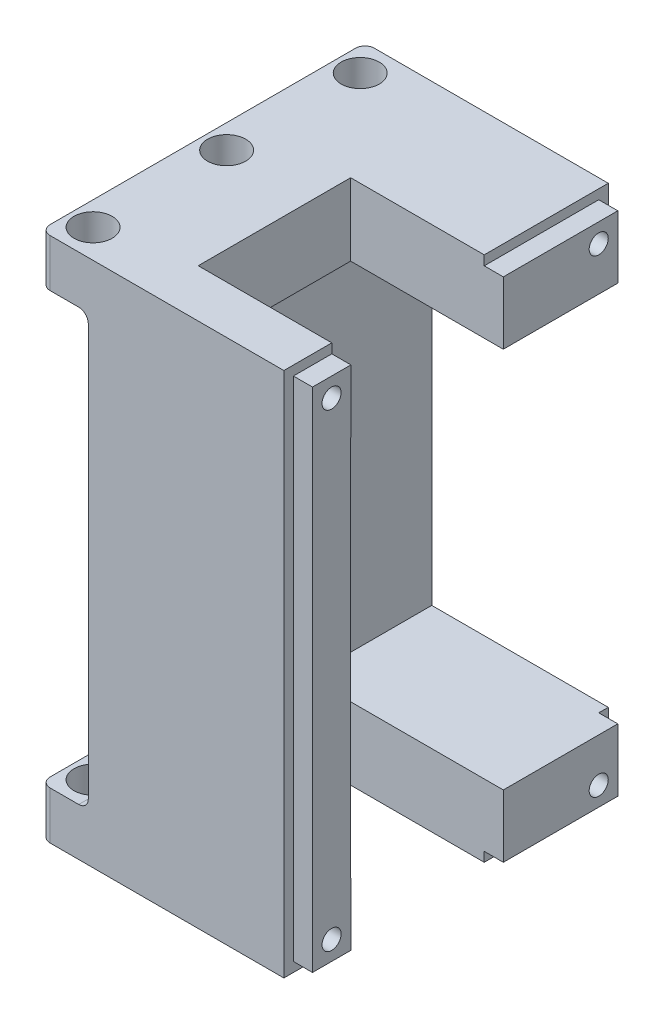
from build123d import *

# Parameters (mm, degrees)
SKETCH_1_R           = 2.000000000000001
EXTRUDE_1_DEPTH      = 29
SKETCH_2_W           = 20.5
SKETCH_2_H           = 70.28340969233892
EXTRUDE_2_DEPTH      = 3
SKETCH_3_W           = 20.5
SKETCH_3_H           = 7.570852423084727
CUT_EXTRUDE_1_DEPTH  = 49.62100286394029
SKETCH_5_R           = 2.5
EXTRUDE_3_DEPTH      = 10
CUT_EXTRUDE_2_REACH  = 75.297
SKETCH_8_R           = 1.6000000000000003
SKETCH_9_W           = 20.5
SKETCH_9_H           = 32
CUT_EXTRUDE_3_DEPTH  = 65.57298284377197
SKETCH_12_W          = 20.499999999999996
SKETCH_12_H          = 7.57085242308473
SKETCH_12_R          = 2.0000000000000018
SKETCH_12_R_2        = 2.000000000000001
EXTRUDE_5_DEPTH      = 30
EXTRUDE_6_DEPTH      = 10
SKETCH_16_R          = 1.5000000000000004
CUT_EXTRUDE_5_DEPTH  = 48.388093987806805
SKETCH_17_R          = 1.5000000000000004
CUT_EXTRUDE_6_DEPTH  = 51.404676958704755
EXTRUDE_START        = 10
SKETCH_19_R          = 4
SKETCH_19_R_2        = 2.5000000000000004
EXTRUDE_7_DEPTH      = 10
SKETCH_21_R          = 1.5000000000000004
CUT_EXTRUDE_7_DEPTH  = 48.38809406709012
SKETCH_22_R          = 1.5000000000000004
CUT_EXTRUDE_8_DEPTH  = 51.404676958704755
SKETCH_23_W          = 20.5
SKETCH_23_H          = 55.141704846169446
EXTRUDE_8_DEPTH      = 2
EXTRUDE_9_DEPTH      = 2
CUT_EXTRUDE_9_DEPTH  = 16
EXTRUDE_START_2      = 20
SKETCH_26_R          = 2.000000000000003
SKETCH_26_R_2        = 2.000000000000001
SKETCH_26_R_3        = 2.000000000000002
EXTRUDE_10_DEPTH     = 20
SKETCH_27_W          = 16
SKETCH_27_H          = 8.000000000000007
CUT_EXTRUDE_10_DEPTH = 75.49499461906014
SKETCH_29_W          = 34
SKETCH_29_H          = 55.14170484616947
CUT_EXTRUDE_11_DEPTH = 2
SKETCH_32_W          = 3.9768627953179667
SKETCH_32_H          = 6.57085242308473
CUT_EXTRUDE_13_DEPTH = 16
SKETCH_33_R          = 1.0000000000000018
CUT_EXTRUDE_14_DEPTH = 16
SKETCH_35_R          = 1.0000000000000004
CUT_EXTRUDE_15_DEPTH = 5
SKETCH_36_R          = 2.65
CUT_EXTRUDE_16_DEPTH = 10
CUT_EXTRUDE_START    = -10
SKETCH_37_R          = 2.65
CUT_EXTRUDE_17_DEPTH = 10
SKETCH_38_W          = 37
SKETCH_38_H          = 68
CUT_EXTRUDE_18_DEPTH = 10
SKETCH_39_W          = 24.000000000000007
SKETCH_39_H          = 55.141704846169446
EXTRUDE_11_DEPTH     = 2
SKETCH_40_W          = 20.5
SKETCH_40_H          = 34
CUT_EXTRUDE_19_DEPTH = 66.92928115292985
EXTRUDE_12_DEPTH     = 5
SKETCH_42_R          = 1.9999999999999991
SKETCH_42_R_2        = 1.9999999999999996
SKETCH_42_R_3        = 2
CUT_EXTRUDE_20_DEPTH = 68.03857183250602
FILLET_1_R           = 1
FILLET_2_R           = 1
FILLET_3_R           = 1
FILLET_4_R           = 1
FILLET_5_R           = 1
FILLET_6_R           = 1


with BuildPart() as part:
    # 草图1 → 凸台-拉伸1 (new body)
    # profile 1 of 3: a face of its own
    with BuildSketch(Plane.XY):
        with BuildLine():
            Line((-10.250000000000004, 35.14170484616946), (-10.250000000000004, 20))
            Line((-10.25, 20.000000000000004), (-4.999999999999999, 20.000000000000004))
            Line((-4.999999999999999, 20.000000000000004), (-4.999999999999999, 23.000000000000004))
            ThreePointArc((-5.000000000000001, 23.000000000000004), (-6.414213562373094, 26.4142135623731), (-2.9999999999999982, 25.000000000000004))
            Line((-2.9999999999999982, 25.000000000000004), (3, 25.000000000000004))
            ThreePointArc((3, 25.000000000000004), (5.000000000000001, 27.000000000000004), (7.000000000000002, 25.000000000000004))
            ThreePointArc((7.000000000000002, 25.000000000000004), (6.414213562373095, 23.585786437626908), (4.999999999999999, 23.000000000000004))
            Line((5.000000000000001, 23.000000000000004), (5.000000000000001, 20.000000000000004))
            Line((5, 20.000000000000004), (10.249999999999996, 20.000000000000004))
            Line((10.249999999999996, 20), (10.249999999999996, 35.14170484616946))
            Line((10.249999999999996, 35.14170484616946), (-10.250000000000004, 35.14170484616946))
        make_face()
    # profile 2 of 3: a face of its own
    with BuildSketch(Plane.XY):
        Polygon((10.249999999999996, -20), (-10.25, -20), (-10.250000000000004, -35.14170484616946), (10.249999999999996, -35.14170484616946), align=None)
        with Locations(Location((-4.999999999999999, -25.000000000000004, 0), (0, 0, 180))):
            Circle(SKETCH_1_R, mode=Mode.SUBTRACT)
        with Locations(Location((5.000000000000001, -25.000000000000004, 0), (0, 0, 180))):
            Circle(SKETCH_1_R, mode=Mode.SUBTRACT)
    # profile 3 of 3: a face of its own
    with BuildSketch(Plane.XY):
        with BuildLine():
            Line((-4.999999999999999, 23.000000000000004), (-4.999999999999999, 20.000000000000004))
            Line((-4.999999999999999, 20.000000000000004), (5, 20.000000000000004))
            Line((5.000000000000001, 20.000000000000004), (5.000000000000001, 23.000000000000004))
            ThreePointArc((4.999999999999999, 23.000000000000004), (3.585786437626904, 23.585786437626908), (3, 25.000000000000004))
            Line((3, 25.000000000000004), (-2.9999999999999982, 25.000000000000004))
            ThreePointArc((-2.9999999999999982, 25.000000000000004), (-3.585786437626905, 23.585786437626908), (-5.000000000000001, 23.000000000000004))
        make_face()
    extrude(amount=EXTRUDE_1_DEPTH)

    # 草图2 → 凸台-拉伸2 (add)
    with BuildSketch(Plane.XY.offset(29)):
        Rectangle(SKETCH_2_W, SKETCH_2_H)
    extrude(amount=EXTRUDE_2_DEPTH)

    # 草图3 → 切除-拉伸1 (cut, through all)
    with BuildSketch(Plane(origin=(0, 0, 0), x_dir=(-1, 0, 0), z_dir=(0, 0, -1))):
        with Locations((3.55e-15, -31.356278634627095)):
            Rectangle(SKETCH_3_W, SKETCH_3_H)
        Polygon((-10.249999999999996, 35.14170484616946), (-10.249999999999996, 27.57085242308473), (10.250000000000004, 27.570852423084734), (10.250000000000004, 35.14170484616946), align=None)
    extrude(amount=-CUT_EXTRUDE_1_DEPTH, mode=Mode.SUBTRACT)

    # 草图5 → 凸台-拉伸3 (add)
    with BuildSketch(Plane.XZ.offset(27.570852423084734)):
        with Locations(Location((0, 2.5, 0), (0, 0, 270))):
            Circle(SKETCH_5_R)
    extrude(amount=EXTRUDE_3_DEPTH)

    # 草图8 → 切除-拉伸2 (cut, up to next)
    with BuildSketch(Plane(origin=(0, 27.570852423084734, 0), x_dir=(1, 0, 0), z_dir=(0, 1, 0)), mode=Mode.PRIVATE) as cut_extrude_2_sk1:
        with Locations(Location((1.71e-15, -16.5, 0), (0, 0, 270))):
            Circle(SKETCH_8_R)
    cut_extrude_2_tool1 = extrude(cut_extrude_2_sk1.sketch, amount=-CUT_EXTRUDE_2_REACH, mode=Mode.PRIVATE) & part.part
    # 草图8 → 切除-拉伸2 (cut, up to next)
    with BuildSketch(Plane(origin=(0, 27.570852423084734, 0), x_dir=(1, 0, 0), z_dir=(0, 1, 0)), mode=Mode.PRIVATE) as cut_extrude_2_sk2:
        with Locations(Location((1.22e-15, -26.500000000000004, 0), (0, 0, 270))):
            Circle(SKETCH_8_R)
    cut_extrude_2_tool2 = extrude(cut_extrude_2_sk2.sketch, amount=-CUT_EXTRUDE_2_REACH, mode=Mode.PRIVATE) & part.part
    add(cut_extrude_2_tool1.solids().sort_by_distance((0, 27.570852, 16.5))[0], mode=Mode.SUBTRACT)
    add(cut_extrude_2_tool2.solids().sort_by_distance((0, 27.570852, 26.5))[0], mode=Mode.SUBTRACT)

    # 草图9 → 切除-拉伸3 (cut, through all)
    with BuildSketch(Plane.XZ.offset(27.570852423084734)):
        with Locations((-3.55e-15, 16)):
            Rectangle(SKETCH_9_W, SKETCH_9_H)
    extrude(amount=CUT_EXTRUDE_3_DEPTH, mode=Mode.SUBTRACT)

    # 草图12 → 凸台-拉伸5 (add)
    with BuildSketch(Plane(origin=(0, 0, 0), x_dir=(-1, 0, 0), z_dir=(0, 0, -1))):
        with Locations((1.78e-15, 23.78542621154237)):
            Rectangle(SKETCH_12_W, SKETCH_12_H)
        with Locations((-5.000000000000001, 25.000000000000004)):
            Circle(SKETCH_12_R, mode=Mode.SUBTRACT)
        with Locations((4.999999999999999, 25.000000000000004)):
            Circle(SKETCH_12_R_2, mode=Mode.SUBTRACT)
    extrude(amount=-EXTRUDE_5_DEPTH)

    # 草图13 → 凸台-拉伸6 (add)
    with BuildSketch(Plane(origin=(0, 27.570852423084734, 0), x_dir=(1, 0, 0), z_dir=(0, 1, 0))):
        with BuildLine():
            ThreePointArc((4.456e-14, -7.5), (-2.5, -5.000000000000058), (-7.084e-14, -2.4999999999999996))
            Line((-1.4e-16, -2.4999999999999996), (-5e-17, -1))
            ThreePointArc((7.635e-14, -1), (-3.9999999999999996, -4.999999999999907), (-1.067e-13, -9))
            Line((-4.9e-16, -9), (-4.1e-16, -7.5))
        make_face()
        with BuildLine():
            Line((-5e-17, -1), (-1.4e-16, -2.4999999999999996))
            ThreePointArc((-7.084e-14, -2.4999999999999996), (1.7677669529663447, -3.2322330470336054), (2.500000000000001, -5))
            ThreePointArc((2.500000000000001, -5.000000000000001), (1.767766952966385, -6.767766952966354), (4.456e-14, -7.5))
            Line((-4.1e-16, -7.5), (-4.9e-16, -9))
            ThreePointArc((-1.067e-13, -9), (2.828427124746152, -7.828427124746229), (4.000000000000001, -5.000000000000001))
            ThreePointArc((4.000000000000001, -5), (2.8284271247462174, -2.171572875253837), (7.635e-14, -1))
        make_face()
    extrude(amount=EXTRUDE_6_DEPTH)

    # 草图15 → 旋转1 (revolve)
    with BuildSketch(Plane(origin=(0, 0, 0), x_dir=(0, 0, -1), z_dir=(1, 0, 0))):
        with BuildLine():
            Line((-1, 27.570852423084734), (0, 27.570852423084734))
            ThreePointArc((0, 27.570852423084734), (-0.7128919117369903, 27.930797461014013), (-1, 28.676011694509246))
            Line((-1, 28.676011694509246), (-1, 27.570852423084734))
        make_face()
    revolve(axis=Axis((0, -962.4291475769152, 4.99999999999657), (0, 1, 3.43e-15)))

    # 草图16 → 切除-拉伸5 (cut, through all)
    with BuildSketch(Plane.XY.offset(5)):
        with Locations(Location((4.9e-16, 33.57085242308473, 0), (0, 0, 90))):
            Circle(SKETCH_16_R)
    extrude(amount=-CUT_EXTRUDE_5_DEPTH, mode=Mode.SUBTRACT)

    # 草图17 → 切除-拉伸6 (cut, through all)
    with BuildSketch(Plane(origin=(0, 0, 0), x_dir=(0, 0, -1), z_dir=(1, 0, 0))):
        with Locations((-5, 33.57085242308473)):
            Circle(SKETCH_17_R)
    extrude(amount=-CUT_EXTRUDE_6_DEPTH, mode=Mode.SUBTRACT)

    # 草图19 → 凸台-拉伸7 (add)
    with BuildSketch(Plane.XZ.offset(27.570852423084734).offset(EXTRUDE_START)):
        with Locations(Location((0, 4.999999999999998, 0), (0, 0, 270))):
            Circle(SKETCH_19_R)
        with Locations(Location((0, 4.999999999999998, 0), (0, 0, 90))):
            Circle(SKETCH_19_R_2, mode=Mode.SUBTRACT)
    extrude(amount=-EXTRUDE_7_DEPTH)

    # 草图20 → 旋转2 (revolve)
    with BuildSketch(Plane(origin=(0, 0, 0), x_dir=(0, 0, -1), z_dir=(1, 0, 0))):
        with BuildLine():
            Line((-0.9999999999999983, -27.570852423084734), (0, -27.570852423084734))
            ThreePointArc((0, -27.570852423084734), (-0.7071067811865462, -27.863745641898188), (-0.9999999999999981, -28.570852423084734))
            Line((-0.9999999999999981, -28.570852423084734), (-0.9999999999999983, -27.570852423084734))
        make_face()
    revolve(axis=Axis((0, -1027.5708524230847, 4.999999999996567), (0, 1, 3.43e-15)))

    # 草图21 → 切除-拉伸7 (cut, through all)
    with BuildSketch(Plane.XY.offset(5)):
        with Locations((0, -33.57085242308473)):
            Circle(SKETCH_21_R)
    extrude(amount=-CUT_EXTRUDE_7_DEPTH, mode=Mode.SUBTRACT)

    # 草图22 → 切除-拉伸8 (cut, through all)
    with BuildSketch(Plane(origin=(0, 0, 0), x_dir=(0, 0, -1), z_dir=(1, 0, 0))):
        with Locations((-5, -33.57085242308473)):
            Circle(SKETCH_22_R)
    extrude(amount=-CUT_EXTRUDE_8_DEPTH, mode=Mode.SUBTRACT)

    # 草图23 → 凸台-拉伸8 (add)
    with BuildSketch(Plane.XY.offset(32)):
        Rectangle(SKETCH_23_W, SKETCH_23_H)
    extrude(amount=EXTRUDE_8_DEPTH)

    # 草图24 → 凸台-拉伸9 (add)
    with BuildSketch(Plane.ZY.offset(10.250000000000004)):
        Polygon((34, 27.570852423084734), (24, 27.570852423084734), (24.000000000000007, -27.570852423084713), (34, -27.57085242308472), align=None)
    extrude(amount=EXTRUDE_9_DEPTH)

    # 草图25 → 切除-拉伸9 (cut)
    with BuildSketch(Plane(origin=(10.249999999999996, 0, 0), x_dir=(0, 0, -1), z_dir=(1, 0, 0))):
        Polygon((-17, -20), (-25.000000000000004, -20), (-25.000000000000004, -27.570852423084713), (-17, -27.570852423084723), align=None)
        Polygon((-21.000000000000004, 27.570852423084734), (-25.000000000000004, 27.570852423084734), (-25.000000000000004, 20.000000000000004), (-17.000000000000004, 20.000000000000004), (-17.000000000000004, 27.570852423084734), align=None)
    extrude(amount=-CUT_EXTRUDE_9_DEPTH, mode=Mode.SUBTRACT)

    # 草图26 → 凸台-拉伸10 (add)
    with BuildSketch(Plane(origin=(0, 0, 29), x_dir=(-1, 0, 0), z_dir=(0, 0, -1)).offset(EXTRUDE_START_2)):
        with Locations((-5.000000000000001, 25.000000000000004)):
            Circle(SKETCH_26_R)
        with Locations((4.999999999999999, 25.000000000000004)):
            Circle(SKETCH_26_R_2)
        with Locations((-5.000000000000001, -25.000000000000004)):
            Circle(SKETCH_26_R_3)
        with Locations((4.999999999999999, -25.000000000000004)):
            Circle(SKETCH_26_R_2)
    extrude(amount=-EXTRUDE_10_DEPTH)

    # 草图27 → 切除-拉伸10 (cut, through all)
    with BuildSketch(Plane.XZ.offset(27.570852423084734)):
        with Locations((2.2499999999999964, 21.000000000000004)):
            Rectangle(SKETCH_27_W, SKETCH_27_H)
    extrude(amount=-CUT_EXTRUDE_10_DEPTH, mode=Mode.SUBTRACT)

    # 草图29 → 切除-拉伸11 (cut)
    with BuildSketch(Plane(origin=(10.249999999999996, 0, 0), x_dir=(0, 0, -1), z_dir=(1, 0, 0))):
        with Locations((-17, 0)):
            Rectangle(SKETCH_29_W, SKETCH_29_H)
        Polygon((-33, 26.570852423084734), (-33, -26.570852423084734), (-1, -26.570852423084734), (-1.0000000000000009, 26.570852423084734), align=None, mode=Mode.SUBTRACT)
    extrude(amount=-CUT_EXTRUDE_11_DEPTH, mode=Mode.SUBTRACT)

    # 草图32 → 切除-拉伸13 (cut)
    with BuildSketch(Plane(origin=(10.249999999999996, 0, 0), x_dir=(0, 0, -1), z_dir=(1, 0, 0))):
        Polygon((-13, 26.570852423084734), (-25.000000000000004, 26.570852423084734), (-25.000000000000004, 20.000000000000004), (-28.97686279531797, 20.000000000000004), (-28.97686279531797, -19.999999999999996), (-25.000000000000004, -20), (-25.000000000000004, -26.570852423084734), (-12.999999999999993, -26.570852423084734), align=None)
        with Locations((-26.988431397658985, 23.28542621154237)):
            Rectangle(SKETCH_32_W, SKETCH_32_H)
        Polygon((-28.97686279531797, -19.999999999999996), (-28.97686279531797, -26.570852423084734), (-25.000000000000004, -26.570852423084734), (-25.000000000000004, -20), align=None)
        Polygon((-25.000000000000004, -26.570852423084734), (-28.97686279531797, -26.570852423084734), (-28.97686279531797, -27.59191586273335), (-12.999999999999995, -27.59191586273335), (-12.999999999999995, -26.57085242308473), align=None)
        Polygon((-28.97686279531797, 27.59388998719103), (-28.97686279531797, 26.570852423084734), (-25.000000000000004, 26.570852423084734), (-13, 26.570852423084734), (-12.999999999999995, 27.59388998719103), align=None)
    extrude(amount=-CUT_EXTRUDE_13_DEPTH, mode=Mode.SUBTRACT)

    # 草图33 → 切除-拉伸14 (cut)
    with BuildSketch(Plane(origin=(10.249999999999996, 0, 0), x_dir=(0, 0, -1), z_dir=(1, 0, 0))):
        with Locations((-31, 24.57085242308473)):
            Circle(SKETCH_33_R)
        with Locations((-31, -24.57085242308473)):
            Circle(SKETCH_33_R)
    extrude(amount=-CUT_EXTRUDE_14_DEPTH, mode=Mode.SUBTRACT)

    # 草图35 → 切除-拉伸15 (cut)
    with BuildSketch(Plane(origin=(10.249999999999996, 0, 0), x_dir=(0, 0, -1), z_dir=(1, 0, 0))):
        with Locations((-3.000000000000001, 24.57085242308473)):
            Circle(SKETCH_35_R)
        with Locations((-3, -24.57085242308473)):
            Circle(SKETCH_35_R)
    extrude(amount=-CUT_EXTRUDE_15_DEPTH, mode=Mode.SUBTRACT)

    # 草图36 → 切除-拉伸16 (cut)
    with BuildSketch(Plane.XZ.offset(37.57085242308474)):
        with Locations(Location((0, 4.999999999999998, 0), (0, 0, 270))):
            Circle(SKETCH_36_R)
    extrude(amount=-CUT_EXTRUDE_16_DEPTH, mode=Mode.SUBTRACT)

    # 草图37 → 切除-拉伸17 (cut)
    with BuildSketch(Plane(origin=(0, 37.57085242308474, 0), x_dir=(1, 0, 0), z_dir=(0, 1, 0)).offset(CUT_EXTRUDE_START)):
        with Locations(Location((0, -4.999999999999965, 0), (0, 0, 90))):
            Circle(SKETCH_37_R)
    extrude(amount=CUT_EXTRUDE_17_DEPTH, mode=Mode.SUBTRACT)

    # 草图38 → 切除-拉伸18 (cut)
    with BuildSketch(Plane.XZ.offset(27.570852423084734)):
        with Locations((-10.250000000000004, 0)):
            Rectangle(SKETCH_38_W, SKETCH_38_H)
    extrude(amount=CUT_EXTRUDE_18_DEPTH, mode=Mode.SUBTRACT)

    # 草图39 → 凸台-拉伸11 (add)
    with BuildSketch(Plane.ZY.offset(10.250000000000004)):
        with Locations((12.000000000000004, 8.88e-15)):
            Rectangle(SKETCH_39_W, SKETCH_39_H)
    extrude(amount=EXTRUDE_11_DEPTH)

    # 草图40 → 切除-拉伸19 (cut, through all)
    with BuildSketch(Plane(origin=(0, 27.570852423084734, 0), x_dir=(1, 0, 0), z_dir=(0, 1, 0))):
        with Locations((-2.0000000000000036, -17)):
            Rectangle(SKETCH_40_W, SKETCH_40_H)
    extrude(amount=CUT_EXTRUDE_19_DEPTH, mode=Mode.SUBTRACT)

    # 草图41 → 凸台-拉伸12 (add)
    with BuildSketch(Plane(origin=(0, 27.570852423084734, 0), x_dir=(1, 0, 0), z_dir=(0, 1, 0))):
        Polygon((-12.250000000000004, 0), (-17.250000000000004, -6.1e-16), (-17.25, -34), (-12.250000000000004, -34), align=None)
    extrude_12 = extrude(amount=-EXTRUDE_12_DEPTH)

    # 镜向1: 凸台-拉伸12 across plane
    add(extrude_12.mirror(Plane.ZX))

    # 草图42 → 切除-拉伸20 (cut, through all)
    with BuildSketch(Plane.XZ.offset(27.570852423084734)):
        with Locations(Location((-14.750000000000002, 31.000000000000004, 0), (0, 0, 270))):
            Circle(SKETCH_42_R)
        with Locations(Location((-14.750000000000005, 2.9999999999999996, 0), (0, 0, 270))):
            Circle(SKETCH_42_R_2)
        with Locations(Location((-14.750000000000002, 17, 0), (0, 0, 270))):
            Circle(SKETCH_42_R_3)
    extrude(amount=-CUT_EXTRUDE_20_DEPTH, mode=Mode.SUBTRACT)

    # 圆角1
    fillet_1_edges = [part.edges().sort_by_distance(p)[0] for p in [
        (-17.25, 25.070852423084734, 34),
    ]]
    fillet(fillet_1_edges, radius=FILLET_1_R)

    # 圆角2
    fillet_2_edges = [part.edges().sort_by_distance(p)[0] for p in [
        (-17.25, -25.070852423084734, 34),
    ]]
    fillet(fillet_2_edges, radius=FILLET_2_R)

    # 圆角3
    fillet_3_edges = [part.edges().sort_by_distance(p)[0] for p in [
        (-17.250000000000004, -25.070852423084734, 6.1e-16),
    ]]
    fillet(fillet_3_edges, radius=FILLET_3_R)

    # 圆角4
    fillet_4_edges = [part.edges().sort_by_distance(p)[0] for p in [
        (-17.250000000000004, 25.070852423084734, 6.1e-16),
    ]]
    fillet(fillet_4_edges, radius=FILLET_4_R)

    # 圆角5
    # the kernel refuses this fillet: 1 mm, written as the material it adds along each edge
    with BuildSketch(Plane(origin=(-12.250000000000004, -22.570852423084734, 34), x_dir=(0, 1, 0), z_dir=(0, 0, -1))) as fillet_5_piece_1_section:
        with BuildLine():
            CenterArc((FILLET_5_R, -FILLET_5_R), FILLET_5_R, 90, 90)
            Line((0, -FILLET_5_R), (0, 0))
            Line((0, 0), (FILLET_5_R, 0))
        make_face()
    fillet_5_piece_1 = extrude(amount=34, mode=Mode.PRIVATE)
    fillet_5_piece_1 = fillet_5_piece_1 - Plane(origin=(-14.750000000000002, -22.34108976077406, 31.000000000000004), x_dir=(-1.8e-16, 0, -1), z_dir=(0, -1, 0)) * Cylinder(1.9999999999999991, 72, mode=Mode.PRIVATE)
    fillet_5_piece_1 = fillet_5_piece_1 - Plane(origin=(-14.750000000000005, -22.34108976077406, 2.9999999999999996), x_dir=(-1.8e-16, 0, -1), z_dir=(0, -1, 0)) * Cylinder(1.9999999999999996, 72, mode=Mode.PRIVATE)
    fillet_5_piece_1 = fillet_5_piece_1 - Plane(origin=(-14.750000000000002, -22.34108976077406, 17), x_dir=(-1.8e-16, 0, -1), z_dir=(0, -1, 0)) * Cylinder(2, 72, mode=Mode.PRIVATE)
    add(fillet_5_piece_1)

    # 圆角6
    # the kernel refuses this fillet: 1 mm, written as the material it adds along each edge
    with BuildSketch(Plane(origin=(-12.250000000000004, 22.570852423084734, 34), x_dir=(0, -1, 0), z_dir=(0, 0, -1))) as fillet_6_piece_1_section:
        with BuildLine():
            CenterArc((FILLET_6_R, FILLET_6_R), FILLET_6_R, 180, 90)
            Line((0, FILLET_6_R), (0, 0))
            Line((0, 0), (FILLET_6_R, 0))
        make_face()
    fillet_6_piece_1 = extrude(amount=34, mode=Mode.PRIVATE)
    fillet_6_piece_1 = fillet_6_piece_1 - Plane(origin=(-14.750000000000002, 22.341089760774064, 31.000000000000004), x_dir=(-1.8e-16, 0, -1), z_dir=(0, -1, 0)) * Cylinder(1.9999999999999991, 72, mode=Mode.PRIVATE)
    fillet_6_piece_1 = fillet_6_piece_1 - Plane(origin=(-14.750000000000005, 22.341089760774064, 2.9999999999999996), x_dir=(-1.8e-16, 0, -1), z_dir=(0, -1, 0)) * Cylinder(1.9999999999999996, 72, mode=Mode.PRIVATE)
    fillet_6_piece_1 = fillet_6_piece_1 - Plane(origin=(-14.750000000000002, 22.341089760774064, 17), x_dir=(-1.8e-16, 0, -1), z_dir=(0, -1, 0)) * Cylinder(2, 72, mode=Mode.PRIVATE)
    add(fillet_6_piece_1)


solid = part.part
